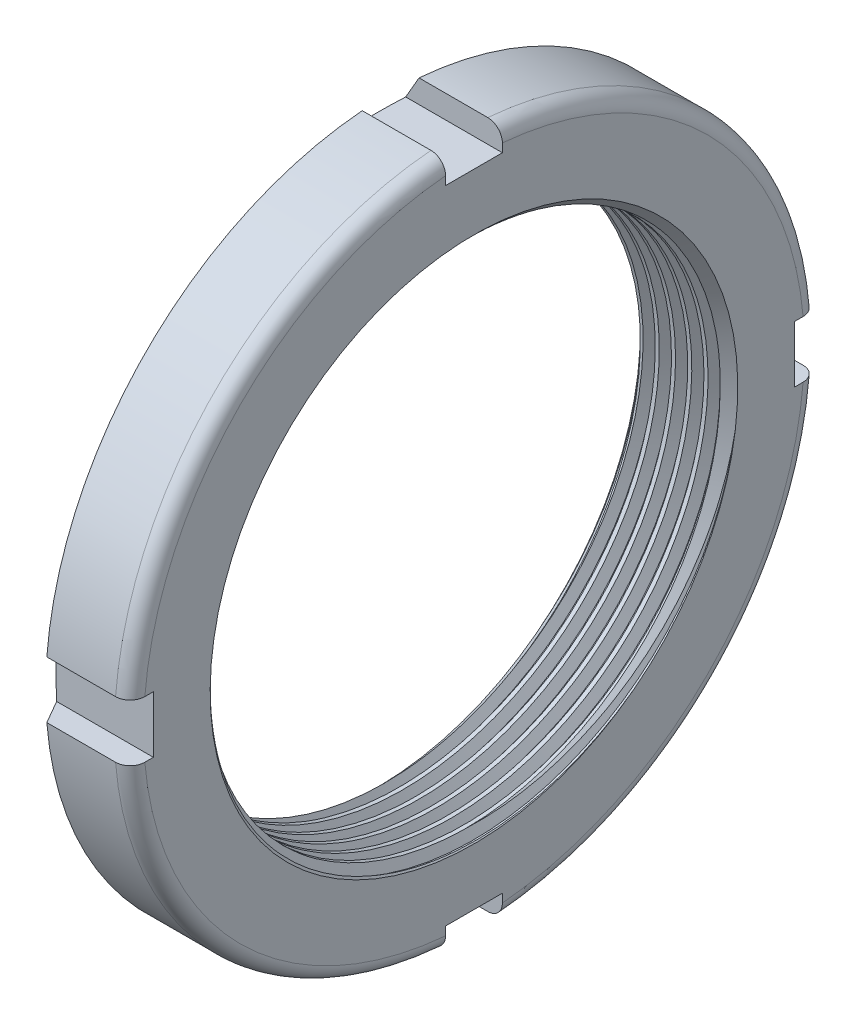
from build123d import *
from OCP.BRepFilletAPI import BRepFilletAPI_MakeChamfer

# Parameters (mm, degrees)
SKETCH1_W             = 12
SKETCH1_H             = 42.5
CUT_EXTRUDE1_DEPTH    = 62.290292869
CUT_EXTRUDE2_DEPTH    = 62.290292869
CUT_EXTRUDE3_DEPTH    = 62.290292869
CUT_EXTRUDE4_DEPTH    = 62.190277005
M56_CLEARANCE_HOLE1_D = 62.835
CHAMFER1_SIZE         = 1.732050808
CHAMFER1_SIZE_2       = 3
CHAMFER2_SIZE         = 1.0825
FILLET1_R             = 1.8
THREAD1_PITCH         = 2


with BuildPart() as part:
    # Sketch1 → Revolve1 (revolve)
    with BuildSketch(Plane(origin=(0, 0, 0), x_dir=(-1, 0, 0), z_dir=(0, 0, -1)), mode=Mode.PRIVATE) as revolve1_sk:
        with Locations((-6, 21.25)):
            Rectangle(SKETCH1_W, SKETCH1_H)
    revolve(revolve1_sk.sketch.rotate(Axis((12, 0, 0), (-1, 0, 0)), 270), axis=Axis((12, 0, 0), (-1, 0, 0)))

    # Sketch2 → Cut-Extrude1 (cut, through all)
    with BuildSketch(Plane(origin=(12, 0, 0), x_dir=(0, 0, -1), z_dir=(1, 0, 0))):
        with BuildLine():
            Line((42.355637169, 3.5), (39.5, 3.5))
            Line((39.5, 3.5), (39.5, -3.5))
            Line((39.5, -3.5), (42.355637169, -3.5))
            ThreePointArc((42.355637169, -3.5), (42.5, 0), (42.355637169, 3.5))
        make_face()
    extrude(amount=-CUT_EXTRUDE1_DEPTH, mode=Mode.SUBTRACT)

    # Sketch3 → Cut-Extrude2 (cut, through all)
    with BuildSketch(Plane(origin=(12, 0, 0), x_dir=(0, 0, -1), z_dir=(1, 0, 0))):
        with BuildLine():
            Line((3.5, -42.355637169), (3.5, -39.5))
            Line((3.5, -39.5), (-3.5, -39.5))
            Line((-3.5, -39.5), (-3.5, -42.355637169))
            ThreePointArc((-3.5, -42.355637169), (0, -42.5), (3.5, -42.355637169))
        make_face()
    extrude(amount=-CUT_EXTRUDE2_DEPTH, mode=Mode.SUBTRACT)

    # Sketch4 → Cut-Extrude3 (cut, through all)
    with BuildSketch(Plane(origin=(12, 0, 0), x_dir=(0, 0, -1), z_dir=(1, 0, 0))):
        with BuildLine():
            Line((-42.355637169, -3.5), (-39.5, -3.5))
            Line((-39.5, -3.5), (-39.5, 3.5))
            Line((-39.5, 3.5), (-42.355637169, 3.5))
            ThreePointArc((-42.355637169, 3.5), (-42.5, 0), (-42.355637169, -3.5))
        make_face()
    extrude(amount=-CUT_EXTRUDE3_DEPTH, mode=Mode.SUBTRACT)

    # Sketch5 → Cut-Extrude4 (cut, through all)
    with BuildSketch(Plane(origin=(12, 0, 0), x_dir=(0, 0, -1), z_dir=(1, 0, 0))):
        with BuildLine():
            Line((-3.5, 42.355637169), (-3.5, 39.5))
            Line((-3.5, 39.5), (3.5, 39.5))
            Line((3.5, 39.5), (3.5, 42.355637169))
            ThreePointArc((3.5, 42.355637169), (0, 42.5), (-3.5, 42.355637169))
        make_face()
    extrude(amount=-CUT_EXTRUDE4_DEPTH, mode=Mode.SUBTRACT)

    # M56 Clearance Hole1 (through all)
    with Locations(Plane.ZY):
        with Locations((0, 0)):
            Hole(M56_CLEARANCE_HOLE1_D / 2)

    # Chamfer1
    chamfer1_edges_1 = [part.edges().sort_by_distance(p)[0] for p in [
        (0, 30.0520382, 30.0520382),
    ]]
    chamfer1_side_1 = [part.faces().sort_by_distance(p)[0] for p in [
        (0.034641016, 30.0520382, 30.0520382),
    ]]
    chamfer1_edges_2 = [part.edges().sort_by_distance(p)[0] for p in [
        (0, -30.0520382, -30.0520382),
    ]]
    chamfer1_side_2 = [part.faces().sort_by_distance(p)[0] for p in [
        (0.034641016, -30.0520382, -30.0520382),
    ]]
    chamfer1_edges_3 = [part.edges().sort_by_distance(p)[0] for p in [
        (0, -30.0520382, 30.0520382),
    ]]
    chamfer1_side_3 = [part.faces().sort_by_distance(p)[0] for p in [
        (0.034641016, -30.0520382, 30.0520382),
    ]]
    chamfer1_edges_4 = [part.edges().sort_by_distance(p)[0] for p in [
        (0, 30.0520382, -30.0520382),
    ]]
    chamfer1_side_4 = [part.faces().sort_by_distance(p)[0] for p in [
        (0.034641016, 30.0520382, -30.0520382),
    ]]
    chamfer1 = BRepFilletAPI_MakeChamfer(part.part.solid().wrapped)
    for e in chamfer1_edges_1:
        chamfer1.Add(CHAMFER1_SIZE - 0.0001, CHAMFER1_SIZE_2 - 0.0001, e.wrapped, chamfer1_side_1[0].wrapped)
    for e in chamfer1_edges_2:
        chamfer1.Add(CHAMFER1_SIZE - 0.0001, CHAMFER1_SIZE_2 - 0.0001, e.wrapped, chamfer1_side_2[0].wrapped)
    for e in chamfer1_edges_3:
        chamfer1.Add(CHAMFER1_SIZE - 0.0001, CHAMFER1_SIZE_2 - 0.0001, e.wrapped, chamfer1_side_3[0].wrapped)
    for e in chamfer1_edges_4:
        chamfer1.Add(CHAMFER1_SIZE - 0.0001, CHAMFER1_SIZE_2 - 0.0001, e.wrapped, chamfer1_side_4[0].wrapped)
    add(Compound.cast(chamfer1.Shape()), mode=Mode.REPLACE)  # a hair under: the kernel refuses the full size

    # Chamfer2
    chamfer2_edges = [part.edges().sort_by_distance(p)[0] for p in [
        (0, 0, 31.4175),
        (12, 0, 31.4175),
    ]]
    chamfer(chamfer2_edges, length=CHAMFER2_SIZE)

    # Fillet1
    fillet1_edges = [part.edges().sort_by_distance(p)[0] for p in [
        (12, -30.0520382, -30.0520382),
        (12, -30.0520382, 30.0520382),
        (12, 30.0520382, 30.0520382),
        (12, 30.0520382, -30.0520382),
    ]]
    fillet(fillet1_edges, radius=FILLET1_R)

    # Thread1: the profile of Thread Profile2 profile screwed along a right-hand helix of 7.5 turns, 10 arcs to a turn; built about Z, then put on its axis
    thread1_z = Axis((0, 0, 0), (0, 0, 1))
    thread1_corners = [(31.4172, 0, -0.000173205), (32.5, 0, 0.624981666), (32.5, 0, 0.874981666), (31.4172, 0, 1.500136538)]
    with BuildLine(mode=Mode.PRIVATE) as thread1_profile:
        Line(thread1_corners[0], thread1_corners[1])
        Line(thread1_corners[1], thread1_corners[2])
        Line(thread1_corners[2], thread1_corners[3])
        Line(thread1_corners[3], thread1_corners[0])
    thread1_cap = Face(thread1_profile.wire())
    thread1_turn_angles = [0, 18, 36, 54, 72, 90, 108, 126, 144, 162, 180, 198, 216, 234, 252, 270, 288, 306, 324, 342, 360]
    thread1_turn_weights = [1, 0.9510565162951535, 1, 0.9510565162951535, 1, 0.9510565162951535, 1, 0.9510565162951535, 1, 0.9510565162951535, 1, 0.9510565162951535, 1, 0.9510565162951535, 1, 0.9510565162951535, 1, 0.9510565162951535, 1, 0.9510565162951535, 1]
    thread1_turn_rails = [Edge.make_bspline([Vector(p[0], p[1], 0).rotate(thread1_z, thread1_turn_angles[k]) / thread1_turn_weights[k] + Vector(0, 0, p[2] + THREAD1_PITCH * thread1_turn_angles[k] / 360) for k in range(21)], [0, 0, 0, 1, 1, 2, 2, 3, 3, 4, 4, 5, 5, 6, 6, 7, 7, 8, 8, 9, 9, 10, 10, 10], 2, thread1_turn_weights) for p in thread1_corners]
    thread1_turn_sides = [Face.make_surface_from_curves(thread1_turn_rails[p[0]], thread1_turn_rails[p[1]]) for p in [(0, 1), (1, 2), (2, 3), (3, 0)]]
    thread1_last_angles = [2520, 2538, 2556, 2574, 2592, 2610, 2628, 2646, 2664, 2682, 2700]
    thread1_last_weights = [1, 0.9510565162951535, 1, 0.9510565162951535, 1, 0.9510565162951535, 1, 0.9510565162951535, 1, 0.9510565162951535, 1]
    thread1_last_rails = [Edge.make_bspline([Vector(p[0], p[1], 0).rotate(thread1_z, thread1_last_angles[k]) / thread1_last_weights[k] + Vector(0, 0, p[2] + THREAD1_PITCH * thread1_last_angles[k] / 360) for k in range(11)], [0, 0, 0, 1, 1, 2, 2, 3, 3, 4, 4, 5, 5, 5], 2, thread1_last_weights) for p in thread1_corners]
    thread1_last_sides = [Face.make_surface_from_curves(thread1_last_rails[p[0]], thread1_last_rails[p[1]]) for p in [(0, 1), (1, 2), (2, 3), (3, 0)]]
    thread1 = Plane(origin=(13.9175, 0, 0), x_dir=(0, 0, 1), z_dir=(-1, 0, 0)) * Solid(Shell([*[p.moved(Location((0, 0, THREAD1_PITCH * i))) for i in range(7) for p in thread1_turn_sides], *thread1_last_sides, thread1_cap, thread1_cap.rotate(thread1_z, 2700).moved(Location((0, 0, THREAD1_PITCH * 2700 / 360)))]))
    add(thread1, mode=Mode.SUBTRACT)


solid = part.part
